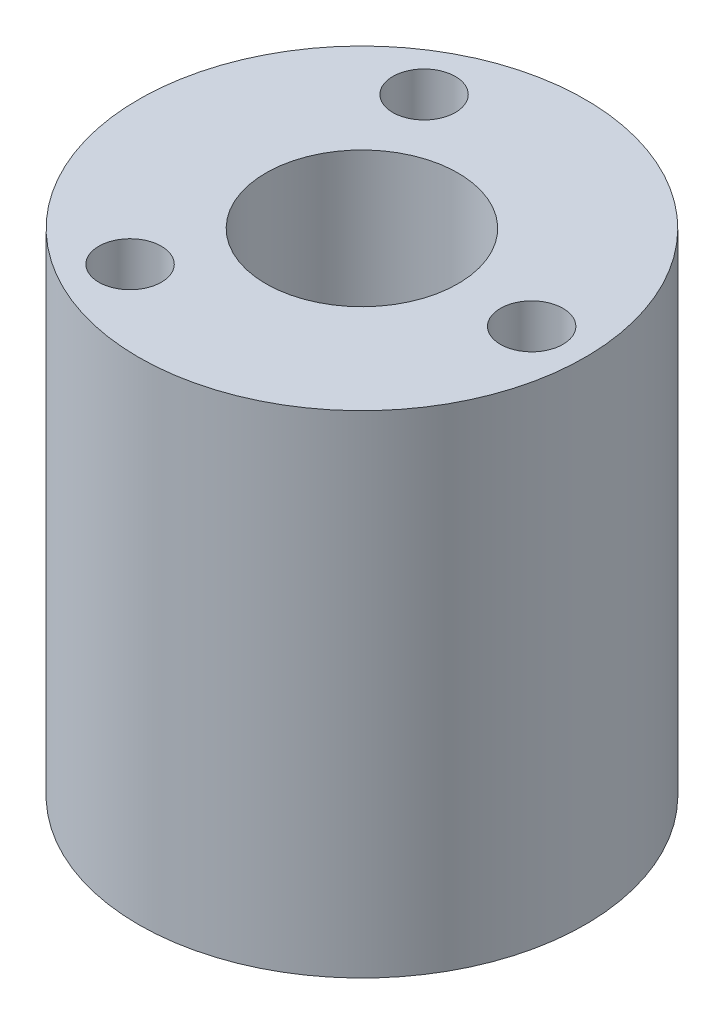
from build123d import *

# Parameters (mm, degrees)
SKETCH1_R           = 5
BOSS_EXTRUDE1_DEPTH = 5.5
SKETCH2_R           = 0.7
CUT_EXTRUDE1_DEPTH  = 2.5
HOLE1_START         = -5.5
HOLE1_OUTLINE_R     = 2.15
HOLE1_DEPTH         = 11


# Read off the part's stored shape, not the designer's step: Hole1
with BuildPart() as part:
    # Sketch1 → Boss-Extrude1 (new, symmetric)
    with BuildSketch(Plane(origin=(0, 0, 0), x_dir=(1, 0, 0), z_dir=(0, 1, 0))):
        with Locations(Location((0, 0, 0), (0, 0, 270))):
            Circle(SKETCH1_R)
    extrude(amount=BOSS_EXTRUDE1_DEPTH, both=True)

    # Sketch2 → Cut-Extrude1 (cut)
    with BuildSketch(Plane(origin=(0, 5.5, 0), x_dir=(1, 0, 0), z_dir=(0, 1, 0))):
        with Locations(Location((3.8, 0, 0), (0, 0, 270))):
            Circle(SKETCH2_R)
        with Locations(Location((-1.9, -3.290896534, 0), (0, 0, 270))):
            Circle(SKETCH2_R)
        with Locations(Location((-1.9, 3.290896534, 0), (0, 0, 270))):
            Circle(SKETCH2_R)
    cut_extrude1 = extrude(amount=-CUT_EXTRUDE1_DEPTH, mode=Mode.SUBTRACT)

    # Mirror1: Cut-Extrude1 across plane
    add(cut_extrude1.mirror(Plane.ZX), mode=Mode.SUBTRACT)

    # Hole1 outline → Hole1 (cut)
    with BuildSketch(Plane(origin=(0, 0, 0), x_dir=(1, 0, 0), z_dir=(0, 1, 0)).offset(HOLE1_START)):
        Circle(HOLE1_OUTLINE_R)
    extrude(amount=HOLE1_DEPTH, mode=Mode.SUBTRACT)


solid = part.part
